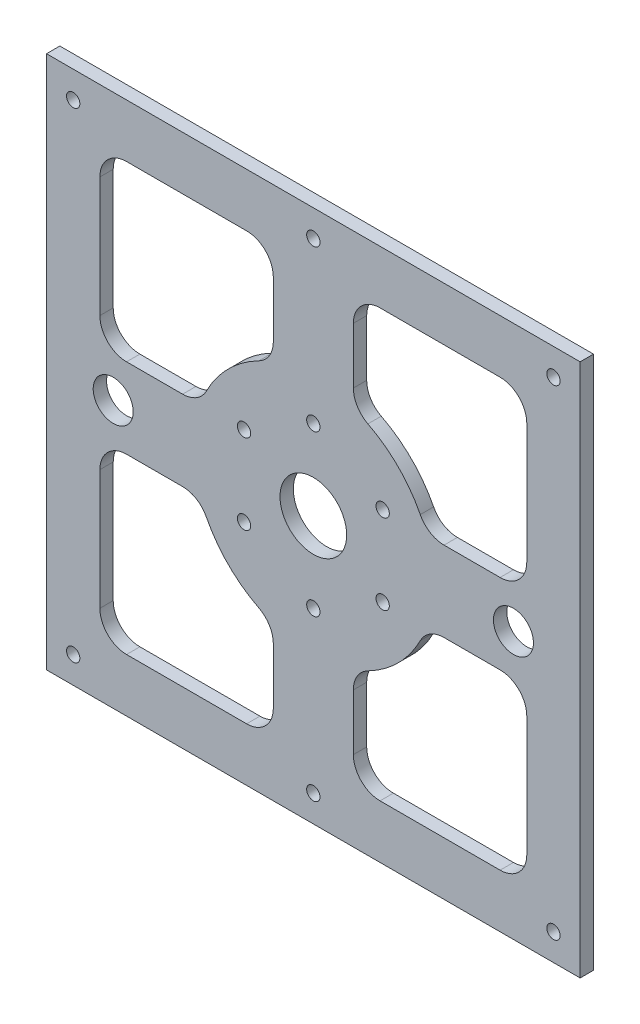
from build123d import *

# Parameters (mm, degrees)
SKETCH_1_W          = 200
SKETCH_1_H          = 200
SKETCH_1_R          = 12.5
EXTRUDE_1_DEPTH     = 5
SKETCH_3_R          = 2.5
CUT_EXTRUDE_2_DEPTH = 142.509716981
SKETCH_4_R          = 2.5
SKETCH_4_R_2        = 7.5
CUT_EXTRUDE_3_DEPTH = 142.509716981
CUT_EXTRUDE_4_DEPTH = 142.509716981


with BuildPart() as part:
    # ｽｹｯﾁ1 → ﾎﾞｽ - 押し出し1 (new body)
    with BuildSketch(Plane.XY):
        Rectangle(SKETCH_1_W, SKETCH_1_H)
        Circle(SKETCH_1_R, mode=Mode.SUBTRACT)
    extrude(amount=EXTRUDE_1_DEPTH)

    # ｽｹｯﾁ3 → ｶｯﾄ - 押し出し2 (cut, through all)
    with BuildSketch(Plane.XY.offset(5)):
        with Locations((0, 90)):
            Circle(SKETCH_3_R)
        with Locations((90, 90)):
            Circle(SKETCH_3_R)
        with Locations((-90, 90)):
            Circle(SKETCH_3_R)
        with Locations((-90, -90)):
            Circle(SKETCH_3_R)
        with Locations((0, -90)):
            Circle(SKETCH_3_R)
        with Locations((90, -90)):
            Circle(SKETCH_3_R)
    extrude(amount=-CUT_EXTRUDE_2_DEPTH, mode=Mode.SUBTRACT)

    # ｽｹｯﾁ4 → ｶｯﾄ - 押し出し3 (cut, through all)
    with BuildSketch(Plane.XY.offset(5)):
        with Locations((0, 30)):
            Circle(SKETCH_4_R)
        with Locations((25.980762114, 15)):
            Circle(SKETCH_4_R)
        with Locations((25.980762114, -15)):
            Circle(SKETCH_4_R)
        with Locations((0, -30)):
            Circle(SKETCH_4_R)
        with Locations((-25.980762114, -15)):
            Circle(SKETCH_4_R)
        with Locations((-25.980762114, 15)):
            Circle(SKETCH_4_R)
        with Locations((-75, 0)):
            Circle(SKETCH_4_R_2)
        with Locations((75, 0)):
            Circle(SKETCH_4_R_2)
    extrude(amount=-CUT_EXTRUDE_3_DEPTH, mode=Mode.SUBTRACT)

    # ｽｹｯﾁ5 → ｶｯﾄ - 押し出し4 (cut, through all)
    with BuildSketch(Plane.XY.offset(5)):
        with BuildLine():
            Line((-80, 70), (-80, 25))
            ThreePointArc((-80, 25), (-77.071067812, 17.928932188), (-70, 15))
            Line((-70, 15), (-48.989794856, 15))
            ThreePointArc((-48.989794856, 15), (-43.767465177, 16.471971346), (-40.082559427, 20.454545455))
            ThreePointArc((-40.082559427, 20.454545455), (-31.819805153, 31.819805153), (-20.454545455, 40.082559427))
            ThreePointArc((-20.454545455, 40.082559427), (-16.471971346, 43.767465177), (-15, 48.989794856))
            Line((-15, 48.989794856), (-15, 70))
            ThreePointArc((-15, 70), (-17.928932188, 77.071067812), (-25, 80))
            Line((-25, 80), (-70, 80))
            ThreePointArc((-70, 80), (-77.071067812, 77.071067812), (-80, 70))
        make_face()
        with BuildLine():
            Line((15, 48.989794856), (15, 70))
            ThreePointArc((15, 70), (17.928932188, 77.071067812), (25, 80))
            Line((25, 80), (70, 80))
            ThreePointArc((70, 80), (77.071067812, 77.071067812), (80, 70))
            Line((80, 70), (80, 25))
            ThreePointArc((80, 25), (77.071067812, 17.928932188), (70, 15))
            Line((70, 15), (48.989794856, 15))
            ThreePointArc((48.989794856, 15), (43.767465177, 16.471971346), (40.082559427, 20.454545455))
            ThreePointArc((40.082559427, 20.454545455), (31.819805153, 31.819805153), (20.454545455, 40.082559427))
            ThreePointArc((20.454545455, 40.082559427), (16.471971346, 43.767465177), (15, 48.989794856))
        make_face()
        with BuildLine():
            Line((15, -48.989794856), (15, -70))
            ThreePointArc((15, -70), (17.928932188, -77.071067812), (25, -80))
            Line((25, -80), (70, -80))
            ThreePointArc((70, -80), (77.071067812, -77.071067812), (80, -70))
            Line((80, -70), (80, -25))
            ThreePointArc((80, -25), (77.071067812, -17.928932188), (70, -15))
            Line((70, -15), (48.989794856, -15))
            ThreePointArc((48.989794856, -15), (43.767465177, -16.471971346), (40.082559427, -20.454545455))
            ThreePointArc((40.082559427, -20.454545455), (31.819805153, -31.819805153), (20.454545455, -40.082559427))
            ThreePointArc((20.454545455, -40.082559427), (16.471971346, -43.767465177), (15, -48.989794856))
        make_face()
        with BuildLine():
            Line((-15, -48.989794856), (-15, -70))
            ThreePointArc((-15, -70), (-17.928932188, -77.071067812), (-25, -80))
            Line((-25, -80), (-70, -80))
            ThreePointArc((-70, -80), (-77.071067812, -77.071067812), (-80, -70))
            Line((-80, -70), (-80, -25))
            ThreePointArc((-80, -25), (-77.071067812, -17.928932188), (-70, -15))
            Line((-70, -15), (-48.989794856, -15))
            ThreePointArc((-48.989794856, -15), (-43.767465177, -16.471971346), (-40.082559427, -20.454545455))
            ThreePointArc((-40.082559427, -20.454545455), (-31.819805153, -31.819805153), (-20.454545455, -40.082559427))
            ThreePointArc((-20.454545455, -40.082559427), (-16.471971346, -43.767465177), (-15, -48.989794856))
        make_face()
    extrude(amount=-CUT_EXTRUDE_4_DEPTH, mode=Mode.SUBTRACT)


solid = part.part
